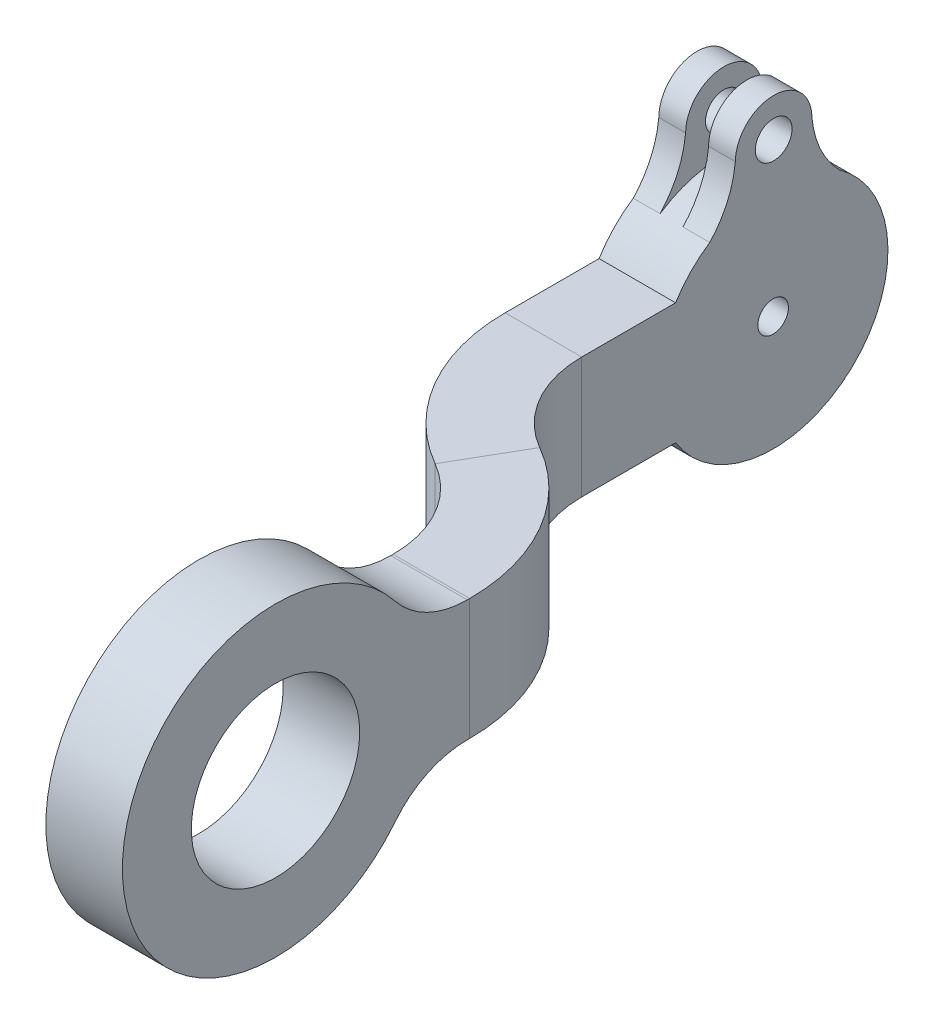
from build123d import *

# Parameters (mm, degrees)
CROQUIS2_W              = 10
CROQUIS2_H              = 15.834903248
CROQUIS4_R              = 15
SALIENTE_EXTRUIR1_DEPTH = 10
CROQUIS5_R              = 20
SALIENTE_EXTRUIR2_DEPTH = 10
SALIENTE_EXTRUIR5_DEPTH = 3.5
CROQUIS13_R             = 2.4
CORTAR_EXTRUIR1_DEPTH   = 10
CROQUIS7_R              = 11
CORTAR_EXTRUIR3_DEPTH   = 10
REDONDEO2_R             = 12
REDONDEO3_R             = 12
CROQUIS14_R             = 11.5
CORTAR_EXTRUIR4_DEPTH   = 5.5
CROQUIS6_R              = 2
CORTAR_EXTRUIR5_DEPTH   = 6


with BuildPart() as part:
    # Barrer1: sweep along a path in Croquis1
    with BuildLine(Plane(origin=(0, 0, 0), x_dir=(1, 0, 0), z_dir=(0, 1, 0))) as barrer1_path:
        Line((-20, 85), (-20, 60))
        ThreePointArc((-20, 60), (-17.320508076, 50), (-10, 42.679491924))
        ThreePointArc((-10, 42.679491924), (-2.679491924, 35.358983849), (0, 25.358983849))
        Line((0, 25.358983849), (0, 0))
    # Croquis2 → Barrer1 (sweep)
    with BuildSketch(Plane.XY):
        Rectangle(CROQUIS2_W, CROQUIS2_H)
    sweep(path=barrer1_path.line)

    # Croquis4 → Saliente-Extruir1 (add)
    with BuildSketch(Plane(origin=(-15, 0, 0), x_dir=(0, 0, -1), z_dir=(1, 0, 0))):
        with Locations((85, 0)):
            Circle(CROQUIS4_R)
    extrude(amount=-SALIENTE_EXTRUIR1_DEPTH)

    # Croquis5 → Saliente-Extruir2 (add)
    with BuildSketch(Plane(origin=(5, 0, 0), x_dir=(0, 0, -1), z_dir=(1, 0, 0))):
        Circle(CROQUIS5_R)
    extrude(amount=-SALIENTE_EXTRUIR2_DEPTH)

    # Croquis12 → Saliente-Extruir5 (add)
    with BuildSketch(Plane(origin=(-15, 0, 0), x_dir=(0, 0, -1), z_dir=(1, 0, 0))):
        with BuildLine():
            ThreePointArc((90.068496439, 19.972615481), (85.068496439, 24.972615481), (80.068496439, 19.972615481))
            add(Edge.make_bspline(
                [(80.068496439, 19.972615481), (79.566731031, 15.028252388), (75.848465439, 11.643922813)],
                knots=[0, 0, 0, 1, 1, 1], degree=2))
            ThreePointArc((75.848465439, 11.643922813), (85.068496439, 14.846363713), (94.288527439, 11.643922813))
            add(Edge.make_bspline(
                [(90.068496439, 19.972615481), (90.570261847, 15.028252388), (94.288527439, 11.643922813)],
                knots=[0, 0, 0, 1, 1, 1], degree=2))
        make_face()
    saliente_extruir5 = extrude(amount=-SALIENTE_EXTRUIR5_DEPTH)

    # Simetría1: Saliente-Extruir5 across plane
    add(saliente_extruir5.mirror(Plane(origin=(-20, 0, 0), x_dir=(0, 0, 1), z_dir=(1, 0, 0))))

    # Croquis13 → Cortar-Extruir1 (cut)
    with BuildSketch(Plane(origin=(-15, 0, 0), x_dir=(0, 0, -1), z_dir=(1, 0, 0))):
        with Locations((85.068496439, 19.972615481)):
            Circle(CROQUIS13_R)
    extrude(amount=-CORTAR_EXTRUIR1_DEPTH, mode=Mode.SUBTRACT)

    # Croquis7 → Cortar-Extruir3 (cut)
    with BuildSketch(Plane(origin=(5, 0, 0), x_dir=(0, 0, -1), z_dir=(1, 0, 0))):
        Circle(CROQUIS7_R)
    extrude(amount=-CORTAR_EXTRUIR3_DEPTH, mode=Mode.SUBTRACT)

    # Redondeo2
    redondeo2_edges = [part.edges().sort_by_distance(p)[0] for p in [
        (0, 7.917451624, -18.366108999),
    ]]
    fillet(redondeo2_edges, radius=REDONDEO2_R)

    # Redondeo3
    redondeo3_edges = [part.edges().sort_by_distance(p)[0] for p in [
        (0, -7.917451624, -18.366108999),
    ]]
    fillet(redondeo3_edges, radius=REDONDEO3_R)

    # Croquis14 → Cortar-Extruir4 (cut)
    with BuildSketch(Plane.ZY.offset(25)):
        with Locations((-85, 0)):
            Circle(CROQUIS14_R)
    extrude(amount=-CORTAR_EXTRUIR4_DEPTH, mode=Mode.SUBTRACT)

    # Croquis6 → Cortar-Extruir5 (cut)
    with BuildSketch(Plane(origin=(-15, 0, 0), x_dir=(0, 0, -1), z_dir=(1, 0, 0))):
        with Locations((85, 0)):
            Circle(CROQUIS6_R)
    extrude(amount=-CORTAR_EXTRUIR5_DEPTH, mode=Mode.SUBTRACT)


solid = part.part
